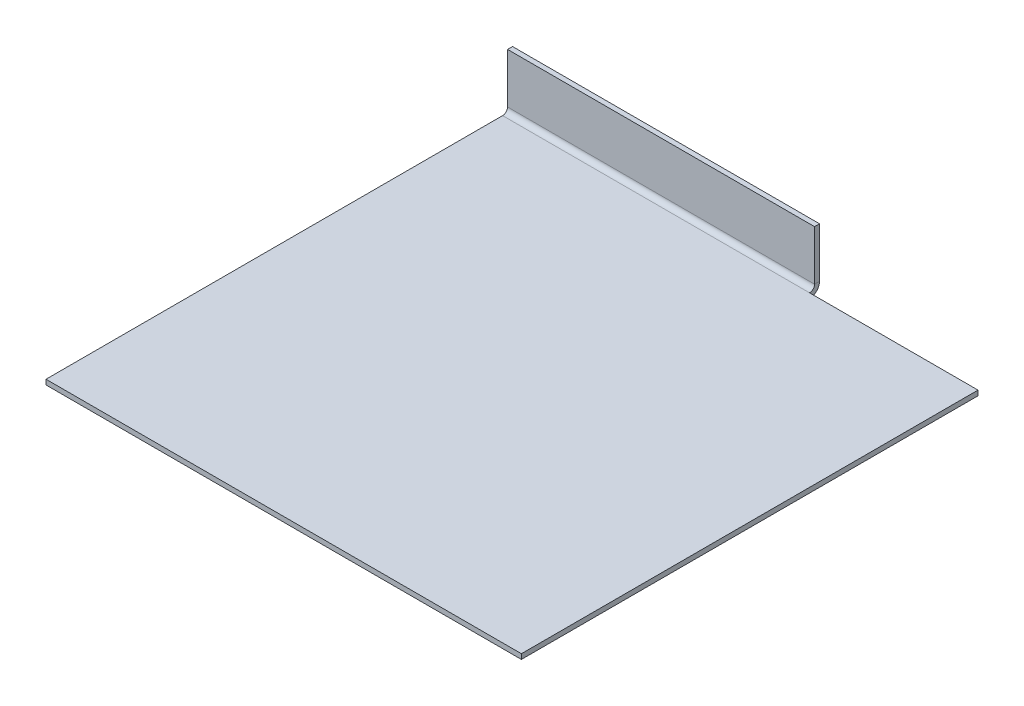
from build123d import *

# Parameters (mm, degrees)
BASE_FLANGE1_DEPTH = 3.175
EDGE_FLANGE1_DEPTH = 195.521520056


# Sheet-metal steps are written as plain solids
with BuildPart() as part:
    # Sketch1 → Base-Flange1 (new body)
    with BuildSketch(Plane(origin=(0, 0, 0), x_dir=(1, 0, 0), z_dir=(0, 1, 0))):
        Polygon((0, 290.83), (-101.6, 290.83), (-101.6, 0), (0, 0), (201.20864, 0), (201.20864, 290.83), align=None)
    extrude(amount=-BASE_FLANGE1_DEPTH)

    # Edge-Flange1 section (across the edge) → Edge-Flange1 (add)
    with BuildSketch(Plane(origin=(93.921520056, 0, -294.005), x_dir=(0, 0, 1), z_dir=(-1, 0, 0))):
        with BuildLine():
            Line((-3.175, 3.175), (-3.175, 34.925))
            Line((-3.175, 34.925), (0, 34.925))
            Line((0, 34.925), (0, 3.175))
            ThreePointArc((0, 3.175), (0.92993597, 0.92993597), (3.175, 0))
            Line((3.175, 0), (3.175, -3.175))
            ThreePointArc((3.175, -3.175), (-1.315128061, -1.315128061), (-3.175, 3.175))
        make_face()
    extrude(amount=EDGE_FLANGE1_DEPTH)


solid = part.part
